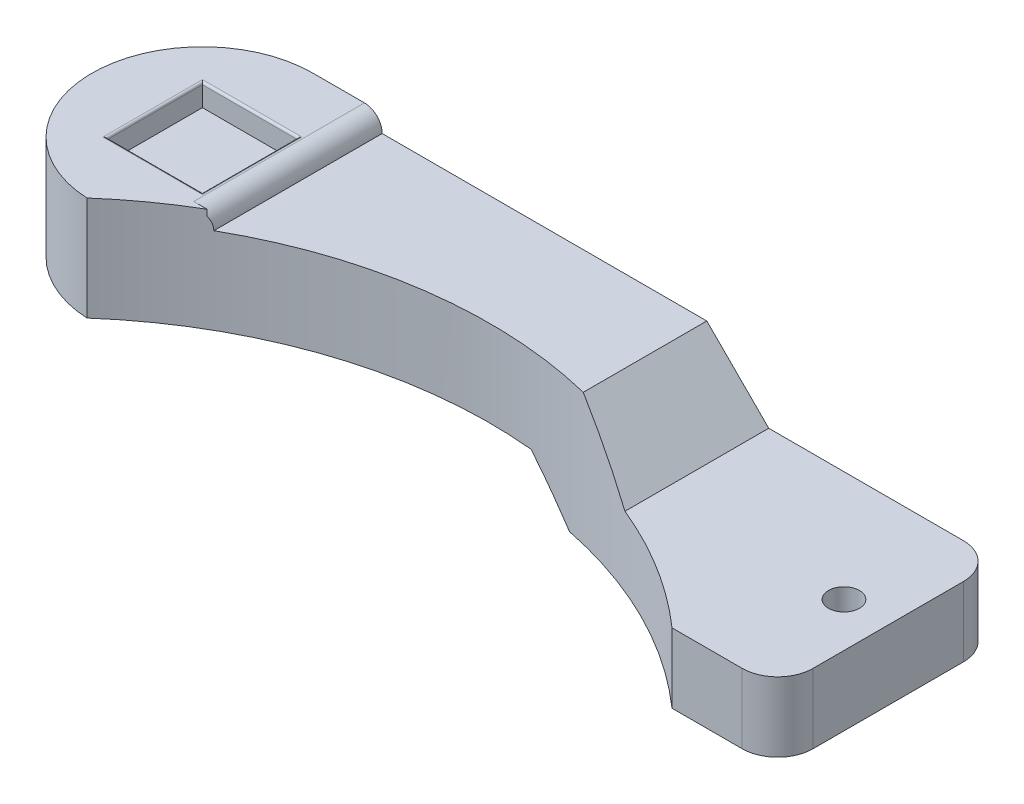
from build123d import *

# Parameters (mm, degrees)
SKETCH1_W                    = 90
SKETCH1_H                    = 25
BOSS_EXTRUDE1_DEPTH          = 16.87
SKETCH3_W                    = 10.75
SKETCH3_H                    = 10.75
CUT_EXTRUDE2_DEPTH           = 2.5
ENL_V_MAT_EXTRU_1_DEPTH      = 34
FILLET1_RADIUS               = 12.5
FILLET1_LENGTH               = 11.75
ESQUISSE5_R                  = 1.75
ENL_V_MAT_EXTRU_4_DEPTH      = 50.65729453
FILLET3_R                    = 4
SKETCH8_W                    = 38.029495875
SKETCH8_H                    = 20.943583685
CUT_EXTRUDE6_DEPTH           = 2
FILLET6_R                    = 2
FILLET7_R                    = 0.25
ESQUISSE17_R                 = 6.45
ENL_V_MAT_EXTRU_7_DEPTH      = 3.6
ENL_V_MAT_EXTRU_8_DEPTH      = 50.65729453
ENL_V_MAT_EXTRU_8_DEPTH_BACK = 50.65729453
ESQUISSE18_R                 = 50


with BuildPart() as part:
    # Sketch1 → Boss-Extrude1 (new body)
    with BuildSketch(Plane(origin=(0, 0, 0), x_dir=(1, 0, 0), z_dir=(0, 1, 0))):
        Rectangle(SKETCH1_W, SKETCH1_H)
    extrude(amount=BOSS_EXTRUDE1_DEPTH)

    # Sketch3 → Cut-Extrude2 (cut)
    with BuildSketch(Plane(origin=(0, 16.87, 0), x_dir=(1, 0, 0), z_dir=(0, 1, 0))):
        with Locations((-32.5, 0)):
            Rectangle(SKETCH3_W, SKETCH3_H)
    extrude(amount=-CUT_EXTRUDE2_DEPTH, mode=Mode.SUBTRACT)

    # Esquisse2 → Enlèv. mat.-Extru.1 (cut)
    with BuildSketch(Plane.XY.offset(12.5)):
        Polygon((45, 16.87), (10, 16.87), (19, 7.87), (45, 7.87), align=None)
        Polygon((-45, 0), (10, 0), (4.88, 5.12), (-45, 5.12), align=None)
    extrude(amount=-ENL_V_MAT_EXTRU_1_DEPTH, mode=Mode.SUBTRACT)

    # Fillet1: full round fillet: the end face becomes a half cylinder, R = half its width
    fillet1_face = Plane((-45, 10.995, 0), x_dir=(0, -1, 0), z_dir=(-1, 0, 0))  # on the end face: x along it, z out of the body
    fillet1_slab = fillet1_face.offset(-FILLET1_RADIUS / 2) * Box(FILLET1_LENGTH, 2 * FILLET1_RADIUS, FILLET1_RADIUS, mode=Mode.PRIVATE)  # the body's end, R deep
    fillet1_round = Plane((-32.5, 10.995, 0), x_dir=(-1, 0, 0), z_dir=(0, -1, 0)) * Cylinder(FILLET1_RADIUS, FILLET1_LENGTH, mode=Mode.PRIVATE)  # its axis R under the face
    add(fillet1_slab - fillet1_round, mode=Mode.SUBTRACT)

    # Esquisse5 → Enlèv. mat.-Extru.4 (cut, through all)
    with BuildSketch(Plane(origin=(0, 0, 0), x_dir=(-1, 0, 0), z_dir=(0, -1, 0))):
        with Locations(Location((-40, 0, 0), (0, 0, 90))):
            Circle(ESQUISSE5_R)
    extrude(amount=-ENL_V_MAT_EXTRU_4_DEPTH, mode=Mode.SUBTRACT)

    # Fillet3
    fillet3_edges = [part.edges().sort_by_distance(p)[0] for p in [
        (45, 3.935, -12.5),
        (45, 3.935, 12.5),
    ]]
    fillet(fillet3_edges, radius=FILLET3_R)

    # Sketch8 → Cut-Extrude6 (cut)
    with BuildSketch(Plane(origin=(0, 16.87, 0), x_dir=(1, 0, 0), z_dir=(0, 1, 0))):
        with Locations((-5.673362901, 3.675760168)):
            Rectangle(SKETCH8_W, SKETCH8_H)
    extrude(amount=-CUT_EXTRUDE6_DEPTH, mode=Mode.SUBTRACT)

    # Fillet6
    fillet6_edges = [part.edges().sort_by_distance(p)[0] for p in [
        (-24.688110839, 16.87, -2.851984162),
    ]]
    fillet(fillet6_edges, radius=FILLET6_R - 0.0001)  # a hair under: the kernel refuses the full size

    # Fillet7
    fillet7_edges = [part.edges().sort_by_distance(p)[0] for p in [
        (-37.875, 16.87, 0),
        (-32.5, 16.87, 5.375),
        (-27.125, 16.87, 0),
        (-32.5, 16.87, -5.375),
    ]]
    fillet(fillet7_edges, radius=FILLET7_R)

    # Esquisse17 → Enlèv. mat.-Extru.7 (cut)
    with BuildSketch(Plane.XZ.offset(-5.12)):
        with Locations((-32.5, 0)):
            Circle(ESQUISSE17_R)
    extrude(amount=-ENL_V_MAT_EXTRU_7_DEPTH, mode=Mode.SUBTRACT)

    # Esquisse18 → Enlèv. mat.-Extru.8 (cut, two sides: drawn at the far end of the back side and taken through both)
    with BuildSketch(Plane(origin=(0, 0, 0), x_dir=(1, 0, 0), z_dir=(0, 1, 0)).offset(-ENL_V_MAT_EXTRU_8_DEPTH_BACK)):
        with Locations((0, -50)):
            Circle(ESQUISSE18_R)
    extrude(amount=ENL_V_MAT_EXTRU_8_DEPTH + ENL_V_MAT_EXTRU_8_DEPTH_BACK, mode=Mode.SUBTRACT)


solid = part.part
